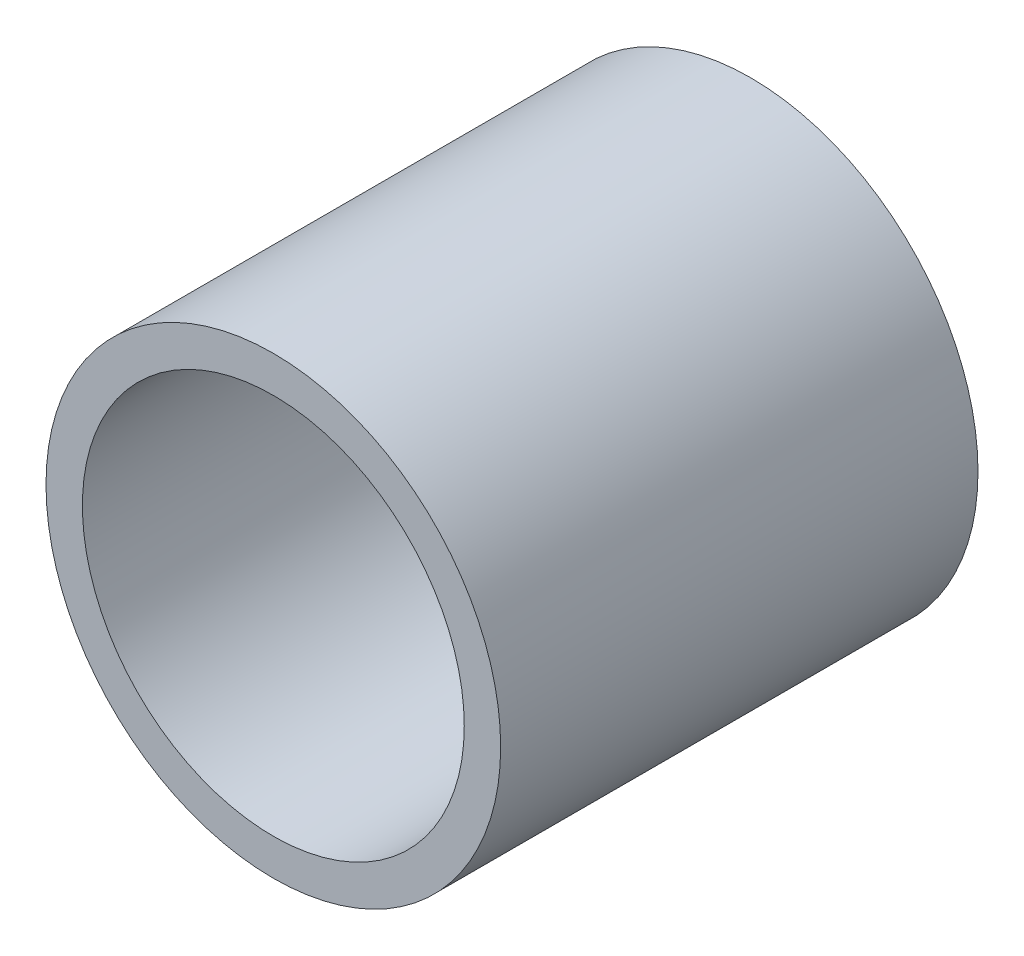
from build123d import *

# Parameters (mm, degrees)
SKETCH1_R           = 24.1935
SKETCH1_R_2         = 20.32
BOSS_EXTRUDE1_DEPTH = 50.8


with BuildPart() as part:
    # Sketch1 → Boss-Extrude1 (new body)
    with BuildSketch(Plane.XY):
        Circle(SKETCH1_R)
        Circle(SKETCH1_R_2, mode=Mode.SUBTRACT)
    extrude(amount=BOSS_EXTRUDE1_DEPTH)


solid = part.part
